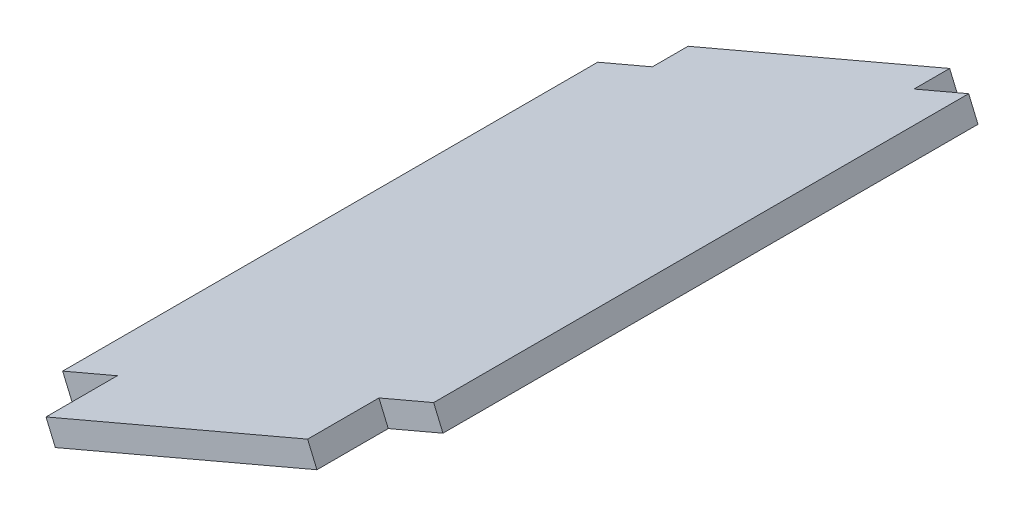
from build123d import *

# Parameters (mm, degrees)
ESTRUSIONE_ESTRUSIONE1_DEPTH      = 48
ESTRUSIONE_ESTRUSIONE1_DEPTH_BACK = 6
SCHIZZO2_W                        = 45
SCHIZZO2_H                        = 2
ESTRUSIONE_ESTRUSIONE2_DEPTH      = 5
CORPO_SPOSTA_COPIA1_START         = 139.953637561
CORPO_SPOSTA_COPIA1_OUTLINE_W     = 2
CORPO_SPOSTA_COPIA1_OUTLINE_H     = 42
CORPO_SPOSTA_COPIA1_DEPTH         = 33.920640211
CORPO_SPOSTA_COPIA1_2_OUTLINE_W   = 2
CORPO_SPOSTA_COPIA1_2_OUTLINE_H   = 6
CORPO_SPOSTA_COPIA1_2_DEPTH       = 5
CORPO_SPOSTA_COPIA1_START_2       = 168.874277772
CORPO_SPOSTA_COPIA1_3_OUTLINE_W   = 2
CORPO_SPOSTA_COPIA1_3_OUTLINE_H   = 6
CORPO_SPOSTA_COPIA1_3_DEPTH       = 5
CORPO_SPOSTA_COPIA1_4_OUTLINE_W   = 2
CORPO_SPOSTA_COPIA1_4_OUTLINE_H   = 45
CORPO_SPOSTA_COPIA1_4_DEPTH       = 33.920640211
CORPO_SPOSTA_COPIA1_START_3       = 144.953637561
CORPO_SPOSTA_COPIA1_5_OUTLINE_W   = 2
CORPO_SPOSTA_COPIA1_5_OUTLINE_H   = 3
CORPO_SPOSTA_COPIA1_5_DEPTH       = 23.920640211


# Read off the part's stored shape, not the designer's step: Corpo-Sposta/copia1
with BuildPart() as part:
    # Schizzo1 → Estrusione-Estrusione1 (new, two sides: drawn at the far end of the back side and taken through both)
    with BuildSketch(Plane.XY.offset(-ESTRUSIONE_ESTRUSIONE1_DEPTH_BACK)):
        Polygon((214.839776844, -73.273463404), (192.836567017, -82.657267824), (193.62114505, -84.496951848), (215.624354877, -75.113147429), align=None)
    extrude(amount=ESTRUSIONE_ESTRUSIONE1_DEPTH + ESTRUSIONE_ESTRUSIONE1_DEPTH_BACK)

    # Schizzo2 → Estrusione-Estrusione2 (add)
    with BuildSketch(Plane(origin=(155.337655494, 66.24752432, 0), x_dir=(0, 0, -1), z_dir=(0.919842012316021, 0.39228901638767966, 0))):
        with Locations((-22.5, -152.679294766)):
            Rectangle(SCHIZZO2_W, SCHIZZO2_H)
    estrusione_estrusione2 = extrude(amount=ESTRUSIONE_ESTRUSIONE2_DEPTH)

    # Specchia1: Estrusione-Estrusione2 across plane
    add(estrusione_estrusione2.mirror(Plane(origin=(144.33605058, 61.55562211, 0), x_dir=(0, 0, 1), z_dir=(0.9198420123160211, 0.3922890163876793, 0))))

    # Corpo-Sposta/copia1 outline → Corpo-Sposta/copia1 (cut)
    with BuildSketch(Plane(origin=(0, 0, 0), x_dir=(-0.39228901638766717, 0.9198420123160262, 0), z_dir=(0.9198420123160264, 0.3922890163876671, 0)).offset(CORPO_SPOSTA_COPIA1_START)):
        with Locations((-152.679294766, 27)):
            Rectangle(CORPO_SPOSTA_COPIA1_OUTLINE_W, CORPO_SPOSTA_COPIA1_OUTLINE_H)
    extrude(amount=CORPO_SPOSTA_COPIA1_DEPTH, mode=Mode.SUBTRACT)

    # Corpo-Sposta_copia1 2 outline → Corpo-Sposta_copia1 2 (cut)
    with BuildSketch(Plane(origin=(0, 0, 0), x_dir=(-0.39228901638766717, 0.9198420123160262, 0), z_dir=(0.9198420123160264, 0.3922890163876671, 0)).offset(CORPO_SPOSTA_COPIA1_START)):
        with Locations((-152.679294766, 3)):
            Rectangle(CORPO_SPOSTA_COPIA1_2_OUTLINE_W, CORPO_SPOSTA_COPIA1_2_OUTLINE_H)
    extrude(amount=CORPO_SPOSTA_COPIA1_2_DEPTH, mode=Mode.SUBTRACT)

    # Corpo-Sposta_copia1 3 outline → Corpo-Sposta_copia1 3 (cut)
    with BuildSketch(Plane(origin=(0, 0, 0), x_dir=(-0.39228901638766717, 0.9198420123160262, 0), z_dir=(0.9198420123160264, 0.3922890163876671, 0)).offset(CORPO_SPOSTA_COPIA1_START_2)):
        with Locations((-152.679294766, 3)):
            Rectangle(CORPO_SPOSTA_COPIA1_3_OUTLINE_W, CORPO_SPOSTA_COPIA1_3_OUTLINE_H)
    extrude(amount=CORPO_SPOSTA_COPIA1_3_DEPTH, mode=Mode.SUBTRACT)

    # Corpo-Sposta_copia1 4 outline → Corpo-Sposta_copia1 4 (add)
    with BuildSketch(Plane(origin=(0, 0, 0), x_dir=(-0.39228901638766717, 0.9198420123160262, 0), z_dir=(0.9198420123160264, 0.3922890163876671, 0)).offset(CORPO_SPOSTA_COPIA1_START)):
        with Locations((-152.679294766, -22.5)):
            Rectangle(CORPO_SPOSTA_COPIA1_4_OUTLINE_W, CORPO_SPOSTA_COPIA1_4_OUTLINE_H)
    extrude(amount=CORPO_SPOSTA_COPIA1_4_DEPTH)

    # Corpo-Sposta_copia1 5 outline → Corpo-Sposta_copia1 5 (add)
    with BuildSketch(Plane(origin=(0, 0, 0), x_dir=(-0.39228901638766717, 0.9198420123160262, 0), z_dir=(0.9198420123160264, 0.3922890163876671, 0)).offset(CORPO_SPOSTA_COPIA1_START_3)):
        with Locations((-152.679294766, -46.5)):
            Rectangle(CORPO_SPOSTA_COPIA1_5_OUTLINE_W, CORPO_SPOSTA_COPIA1_5_OUTLINE_H)
    extrude(amount=CORPO_SPOSTA_COPIA1_5_DEPTH)


solid = part.part
